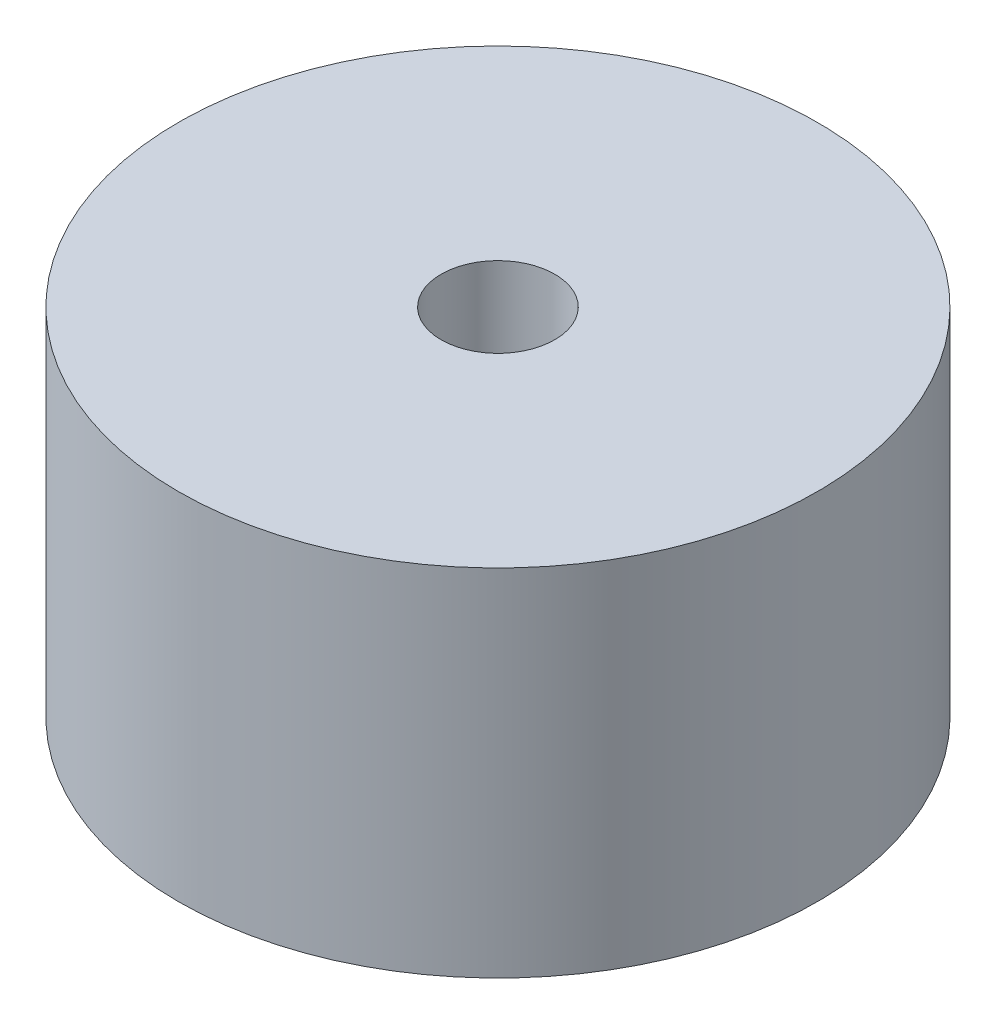
from build123d import *

# Parameters (mm, degrees)
ESQUISSE1_R              = 22.5
ESQUISSE1_R_2            = 4
BOSS_EXTRU_1_DEPTH       = 25
EMPREINTE2_OUTLINE_R     = 4
EMPREINTE2_DEPTH         = 3
EMPREINTE2_START         = 3
EMPREINTE2_2_OUTLINE_R   = 4.8
EMPREINTE2_2_OUTLINE_R_2 = 4
EMPREINTE2_2_DEPTH       = 3.5


# Read off the part's stored shape, not the designer's step: Empreinte2
with BuildPart() as part:
    # Esquisse1 → Boss.-Extru.1 (new body)
    with BuildSketch(Plane(origin=(0, 0, 0), x_dir=(1, 0, 0), z_dir=(0, 1, 0))):
        with Locations(Location((0, 0, 0), (0, 0, 270))):
            Circle(ESQUISSE1_R)
        with Locations(Location((0, 0, 0), (0, 0, 270))):
            Circle(ESQUISSE1_R_2, mode=Mode.SUBTRACT)
    extrude(amount=BOSS_EXTRU_1_DEPTH)

    # Empreinte2 outline → Empreinte2 (cut)
    with BuildSketch(Plane(origin=(0, 0, 0), x_dir=(1, 0, 0), z_dir=(0, 1, 0))):
        with BuildLine():
            ThreePointArc((16.901774097, 6.031934529), (17.724046015, 9.265969613), (14.599132464, 10.436452132))
            Line((14.599132464, 10.436452132), (3.932151869, 6.270816496))
            ThreePointArc((3.932151869, 6.270816496), (1.943748033, 6.202567499), (0.349915852, 7.393410359))
            Line((0.349915852, 7.393410359), (-6.031934529, 16.901774097))
            ThreePointArc((-6.031934529, 16.901774097), (-9.265969613, 17.724046015), (-10.436452132, 14.599132464))
            Line((-10.436452132, 14.599132464), (-6.270816496, 3.932151869))
            ThreePointArc((-6.270816496, 3.932151869), (-6.202567499, 1.943748033), (-7.393410359, 0.349915852))
            Line((-7.393410359, 0.349915852), (-16.901774097, -6.031934529))
            ThreePointArc((-16.901774097, -6.031934529), (-17.724046015, -9.265969613), (-14.599132464, -10.436452132))
            Line((-14.599132464, -10.436452132), (-3.932151869, -6.270816496))
            ThreePointArc((-3.932151869, -6.270816496), (-1.943748033, -6.202567499), (-0.349915852, -7.393410359))
            Line((-0.349915852, -7.393410359), (6.031934529, -16.901774097))
            ThreePointArc((6.031934529, -16.901774097), (9.265969613, -17.724046015), (10.436452132, -14.599132464))
            Line((10.436452132, -14.599132464), (6.270816496, -3.932151869))
            ThreePointArc((6.270816496, -3.932151869), (6.202567499, -1.943748033), (7.393410359, -0.349915852))
            Line((7.393410359, -0.349915852), (16.901774097, 6.031934529))
        make_face()
        Circle(EMPREINTE2_OUTLINE_R, mode=Mode.SUBTRACT)
    extrude(amount=EMPREINTE2_DEPTH, mode=Mode.SUBTRACT)

    # Empreinte2 2 outline → Empreinte2 2 (cut)
    with BuildSketch(Plane(origin=(0, 0, 0), x_dir=(1, 0, 0), z_dir=(0, 1, 0)).offset(EMPREINTE2_START)):
        Circle(EMPREINTE2_2_OUTLINE_R)
        Circle(EMPREINTE2_2_OUTLINE_R_2, mode=Mode.SUBTRACT)
    extrude(amount=EMPREINTE2_2_DEPTH, mode=Mode.SUBTRACT)


solid = part.part
